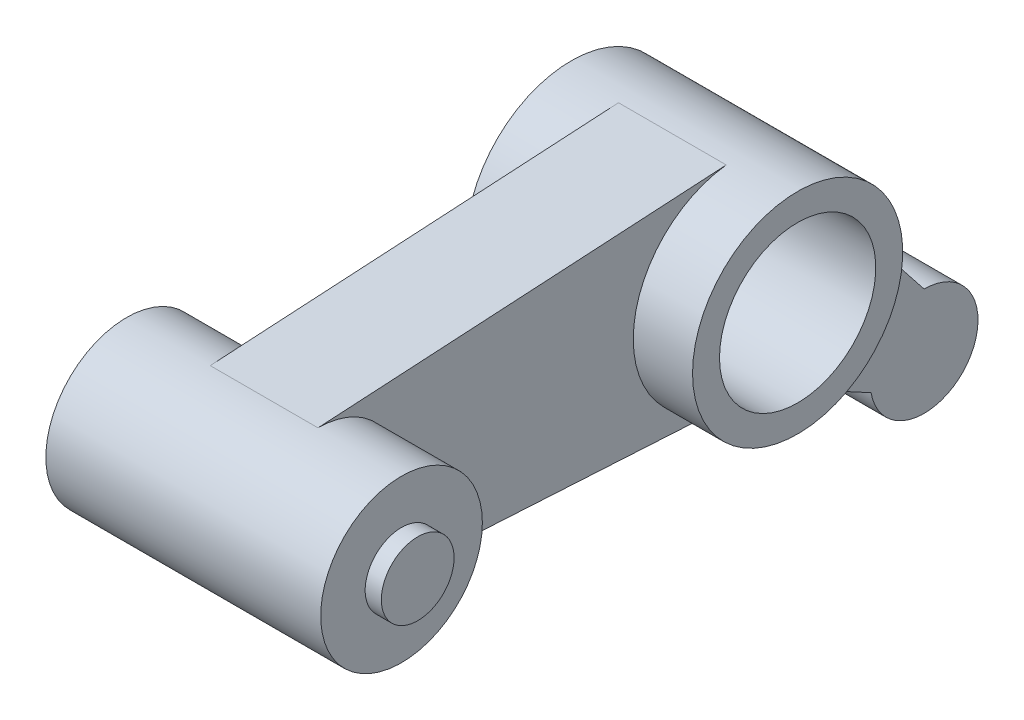
from build123d import *
from build123d.topology import SkipClean

# Parameters (mm, degrees)
EXTRUDE_1_DEPTH      = 10
EXTRUDE_1_DEPTH_BACK = 10
EXTRUDE_2_DEPTH      = 25.5
EXTRUDE_2_DEPTH_BACK = 25.5
SKETCH_3_R           = 8
EXTRUDE_3_DEPTH      = 3
SKETCH_4_R           = 6.75
EXTRUDE_4_DEPTH      = 3
EXTRUDE_5_DEPTH      = 11
EXTRUDE_5_DEPTH_BACK = 31
SKETCH_5_R           = 19.5
SKETCH_5_R_2         = 14.5
SKETCH_5_2_R         = 14.5
CUT_EXTRUDE_1_DEPTH  = 5
CUT_EXTRUDE_START    = -5
SKETCH_6_R           = 14.5
CUT_EXTRUDE_2_DEPTH  = 5
SKETCH_7_R           = 6.75
CUT_EXTRUDE_3_DEPTH  = 15
CUT_EXTRUDE_START_2  = -8
SKETCH_8_R           = 14.5
SKETCH_8_R_2         = 8
CUT_EXTRUDE_4_DEPTH  = 8
SKETCH_9_R           = 8.148618905
CUT_EXTRUDE_5_DEPTH  = 4


with BuildPart() as part:
    # ｽｹｯﾁ1 → ﾎﾞｽ - 押し出し1 (new, two sides: drawn at the far end of the back side and taken through both)
    with BuildSketch(Plane(origin=(0, 0, 0), x_dir=(0, 0, -1), z_dir=(1, 0, 0)).offset(-EXTRUDE_1_DEPTH_BACK)):
        with BuildLine():
            ThreePointArc((0, -19.5), (1.699536984, -19.425796613), (3.386139465, -19.203751184))
            Line((3.386139465, -19.203751184), (24.62392241, -30.661924213))
            ThreePointArc((24.62392241, -30.661924213), (42.132444372, -35.353318533), (34.47199994, -18.925442436))
            Line((34.47199994, -18.925442436), (19.5, 0))
            ThreePointArc((19.5, 0), (13.788582233, 13.788582233), (0, 19.5))
            Line((0, 19.5), (-78, 15))
            ThreePointArc((-78, 15), (-93, 0), (-78, -15))
            Line((-78, -15), (0, -19.5))
        make_face()
    extrude(amount=EXTRUDE_1_DEPTH + EXTRUDE_1_DEPTH_BACK)

    # ｽｹｯﾁ1<3> → ﾎﾞｽ - 押し出し2 (add, two sides: drawn at the far end of the back side and taken through both)
    with BuildSketch(Plane(origin=(0, 0, 0), x_dir=(0, 0, -1), z_dir=(1, 0, 0)).offset(-EXTRUDE_2_DEPTH_BACK)):
        with BuildLine():
            ThreePointArc((-78, -15), (-67.393398282, -10.606601718), (-63, 0))
            ThreePointArc((-63, 0), (-67.393398282, 10.606601718), (-78, 15))
            ThreePointArc((-78, 15), (-93, 0), (-78, -15))
        make_face()
    extrude(amount=EXTRUDE_2_DEPTH + EXTRUDE_2_DEPTH_BACK)

    # ｽｹｯﾁ3 → ﾎﾞｽ - 押し出し3 (add)
    with BuildSketch(Plane.ZY.offset(25.5)):
        with Locations((78, 0)):
            Circle(SKETCH_3_R)
    extrude(amount=EXTRUDE_3_DEPTH)

    # ｽｹｯﾁ4 → ﾎﾞｽ - 押し出し4 (add)
    with BuildSketch(Plane(origin=(25.5, 0, 0), x_dir=(0, 0, -1), z_dir=(1, 0, 0))):
        with Locations((-78, 0)):
            Circle(SKETCH_4_R)
    extrude(amount=EXTRUDE_4_DEPTH)

    # ｽｹｯﾁ5 → ﾎﾞｽ - 押し出し5 (add, two sides: drawn at the far end of the back side and taken through both)
    with SkipClean():  # the faces are left unmerged after this step: merging them gives an invalid solid
        with BuildSketch(Plane.ZY.offset(10).offset(-EXTRUDE_5_DEPTH_BACK)):
            Circle(SKETCH_5_R)
            Circle(SKETCH_5_R_2, mode=Mode.SUBTRACT)
        extrude(amount=EXTRUDE_5_DEPTH + EXTRUDE_5_DEPTH_BACK)

    # ｽｹｯﾁ5<2> → ｶｯﾄ - 押し出し1 (cut)
    with SkipClean():  # the faces are left unmerged after this step: merging them gives an invalid solid
        with BuildSketch(Plane.ZY.offset(10)):
            Circle(SKETCH_5_2_R)
        extrude(amount=-CUT_EXTRUDE_1_DEPTH, mode=Mode.SUBTRACT)

    # ｽｹｯﾁ6 → ｶｯﾄ - 押し出し2 (cut)
    with SkipClean():  # the faces are left unmerged after this step: merging them gives an invalid solid
        with BuildSketch(Plane(origin=(10, 0, 0), x_dir=(0, 0, -1), z_dir=(1, 0, 0)).offset(CUT_EXTRUDE_START)):
            Circle(SKETCH_6_R)
        extrude(amount=CUT_EXTRUDE_2_DEPTH, mode=Mode.SUBTRACT)

    # ｽｹｯﾁ7 → ｶｯﾄ - 押し出し3 (cut)
    with SkipClean():  # the faces are left unmerged after this step: merging them gives an invalid solid
        with BuildSketch(Plane.ZY.offset(5)):
            Circle(SKETCH_7_R)
        extrude(amount=-CUT_EXTRUDE_3_DEPTH, mode=Mode.SUBTRACT)

    # ｽｹｯﾁ8 → ｶｯﾄ - 押し出し4 (cut)
    with SkipClean():  # the faces are left unmerged after this step: merging them gives an invalid solid
        with BuildSketch(Plane(origin=(5, 0, 0), x_dir=(0, 0, -1), z_dir=(1, 0, 0)).offset(CUT_EXTRUDE_START_2)):
            Circle(SKETCH_8_R)
            Circle(SKETCH_8_R_2, mode=Mode.SUBTRACT)
        extrude(amount=CUT_EXTRUDE_4_DEPTH, mode=Mode.SUBTRACT)

    # ｽｹｯﾁ9 → ｶｯﾄ - 押し出し5 (cut)
    with SkipClean():  # the faces are left unmerged after this step: merging them gives an invalid solid
        with BuildSketch(Plane(origin=(5, 0, 0), x_dir=(0, 0, -1), z_dir=(1, 0, 0))):
            Circle(SKETCH_9_R)
        extrude(amount=-CUT_EXTRUDE_5_DEPTH, mode=Mode.SUBTRACT)


solid = part.part
